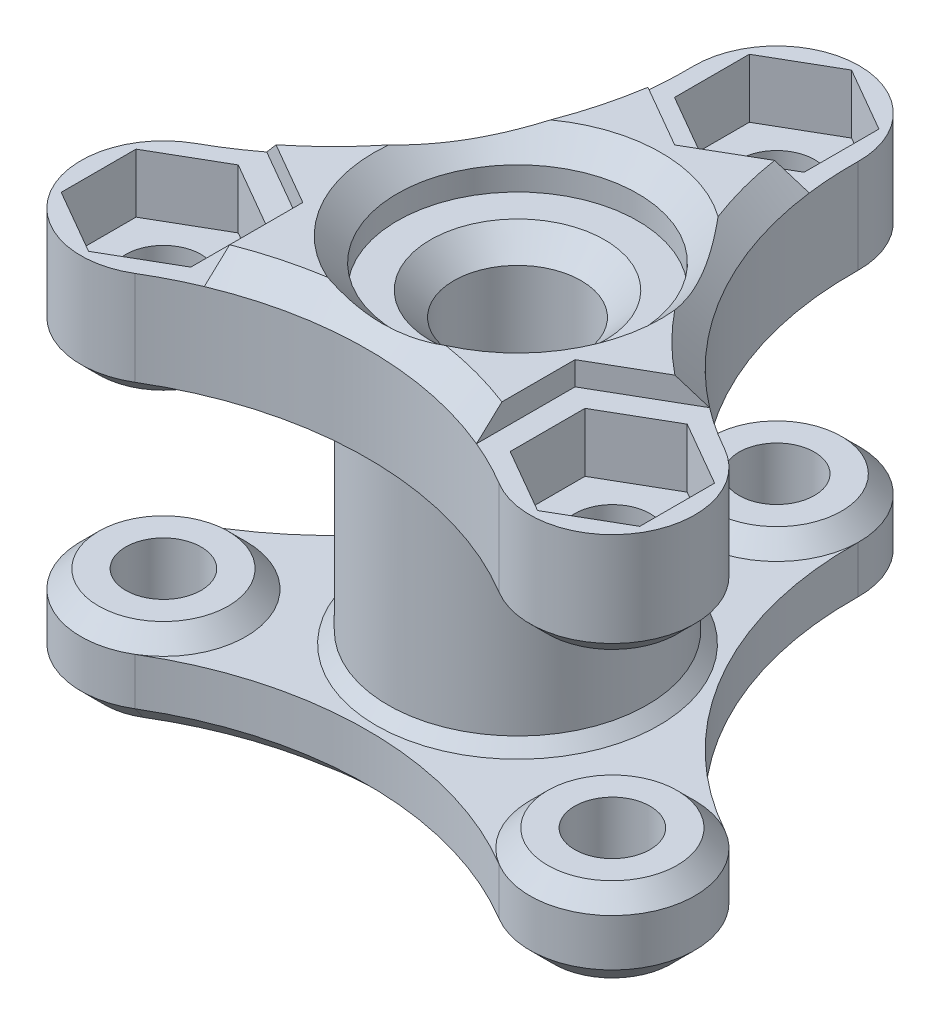
from build123d import *

# Parameters (mm, degrees)
SKETCH1_R           = 1.6
SKETCH1_R_2         = 2.7
BOSS_EXTRUDE1_DEPTH = 3
SKETCH2_R           = 5.5
SKETCH2_R_2         = 2.7
BOSS_EXTRUDE2_DEPTH = 10
SKETCH3_R           = 2.7
SKETCH3_R_2         = 1.6
BOSS_EXTRUDE3_DEPTH = 5
CUT_EXTRUDE2_DEPTH  = 3.5
SKETCH8_R           = 2.5
SKETCH8_R_2         = 1.6
BOSS_EXTRUDE5_DEPTH = 0.75
BOSS_EXTRUDE6_START = 0.75
SKETCH9_R           = 2.5
SKETCH9_R_2         = 1.6
BOSS_EXTRUDE6_DEPTH = 0.75
SKETCH10_R          = 5.1
CUT_EXTRUDE3_DEPTH  = 2
CUT_EXTRUDE4_START  = -3
SKETCH11_R          = 5.1
CUT_EXTRUDE4_DEPTH  = 3
CHAMFER1_SIZE       = 1
CHAMFER2_SIZE       = 1
CHAMFER3_SIZE       = 1
CUT_EXTRUDE5_DEPTH  = 1
CHAMFER4_SIZE       = 0.5
CHAMFER5_SIZE       = 1


with BuildPart() as part:
    # Sketch1 → Boss-Extrude1 (new body)
    with BuildSketch(Plane(origin=(0, 0, 0), x_dir=(1, 0, 0), z_dir=(0, 1, 0))):
        with BuildLine():
            ThreePointArc((3.499474322, 10.939341361), (0, 14.5), (-3.499474322, 10.939341361))
            ThreePointArc((-3.499474322, 10.939341361), (-5.506840359, 3.179375764), (-11.22348468, -2.439037018))
            ThreePointArc((-11.22348468, -2.439037018), (-12.557368355, -7.25), (-7.724010358, -8.500304343))
            ThreePointArc((-7.724010358, -8.500304343), (0, -6.358751527), (7.724010358, -8.500304343))
            ThreePointArc((7.724010358, -8.500304343), (12.557368355, -7.25), (11.22348468, -2.439037018))
            ThreePointArc((11.22348468, -2.439037018), (5.506840359, 3.179375764), (3.499474322, 10.939341361))
        make_face()
        with Locations(Location((0, 11, 0), (0, 0, 270))):
            Circle(SKETCH1_R, mode=Mode.SUBTRACT)
        with Locations(Location((9.526279442, -5.5, 0), (0, 0, 270))):
            Circle(SKETCH1_R, mode=Mode.SUBTRACT)
        with Locations(Location((-9.526279442, -5.5, 0), (0, 0, 270))):
            Circle(SKETCH1_R, mode=Mode.SUBTRACT)
        with Locations(Location((0, 0, 0), (0, 0, 270))):
            Circle(SKETCH1_R_2, mode=Mode.SUBTRACT)
    extrude(amount=BOSS_EXTRUDE1_DEPTH)

    # Sketch2 → Boss-Extrude2 (add)
    with BuildSketch(Plane(origin=(0, 3, 0), x_dir=(1, 0, 0), z_dir=(0, 1, 0))):
        with Locations(Location((0, 0, 0), (0, 0, 270))):
            Circle(SKETCH2_R)
        with Locations(Location((0, 0, 0), (0, 0, 270))):
            Circle(SKETCH2_R_2, mode=Mode.SUBTRACT)
    extrude(amount=BOSS_EXTRUDE2_DEPTH)

    # Sketch3 → Boss-Extrude3 (add)
    with BuildSketch(Plane(origin=(0, 13, 0), x_dir=(1, 0, 0), z_dir=(0, 1, 0))):
        with BuildLine():
            ThreePointArc((-11.22348468, -2.439037018), (-5.506840359, 3.179375764), (-3.499474322, 10.939341361))
            ThreePointArc((-3.499474322, 10.939341361), (0, 14.5), (3.499474322, 10.939341361))
            ThreePointArc((3.499474322, 10.939341361), (5.506840359, 3.179375764), (11.22348468, -2.439037018))
            ThreePointArc((11.22348468, -2.439037018), (12.557368355, -7.25), (7.724010358, -8.500304343))
            ThreePointArc((7.724010358, -8.500304343), (0, -6.358751527), (-7.724010358, -8.500304343))
            ThreePointArc((-7.724010358, -8.500304343), (-12.557368355, -7.25), (-11.22348468, -2.439037018))
        make_face()
        with Locations(Location((0, 0, 0), (0, 0, 270))):
            Circle(SKETCH3_R, mode=Mode.SUBTRACT)
        with Locations(Location((-9.526279442, -5.5, 0), (0, 0, 270))):
            Circle(SKETCH3_R_2, mode=Mode.SUBTRACT)
        with Locations(Location((9.526279442, -5.5, 0), (0, 0, 270))):
            Circle(SKETCH3_R_2, mode=Mode.SUBTRACT)
        with Locations(Location((0, 11, 0), (0, 0, 270))):
            Circle(SKETCH3_R_2, mode=Mode.SUBTRACT)
    extrude(amount=BOSS_EXTRUDE3_DEPTH)

    # Sketch6 → Cut-Extrude2 (cut)
    with BuildSketch(Plane.XZ.offset(-18)):
        Polygon((-12.276279442, 3.91228676), (-9.526279442, 2.324573519), (-6.776279442, 3.91228676), (-6.776279442, 7.08771324), (-9.526279442, 8.675426481), (-12.276279442, 7.08771324), align=None)
        Polygon((2.75, -12.58771324), (2.75, -9.41228676), (0, -7.824573519), (-2.75, -9.41228676), (-2.75, -12.58771324), (0, -14.175426481), align=None)
        Polygon((9.526279442, 8.675426481), (6.776279442, 7.08771324), (6.776279442, 3.91228676), (9.526279442, 2.324573519), (12.276279442, 3.91228676), (12.276279442, 7.08771324), align=None)
    extrude(amount=CUT_EXTRUDE2_DEPTH, mode=Mode.SUBTRACT)

    # Sketch8 → Boss-Extrude5 (add)
    # profile 1 of 3: a face of its own
    with BuildSketch(Plane(origin=(0, 3, 0), x_dir=(1, 0, 0), z_dir=(0, 1, 0))):
        with Locations(Location((-9.526279442, -5.5, 0), (0, 0, 90))):
            Circle(SKETCH8_R)
        with Locations(Location((-9.526279442, -5.5, 0), (0, 0, 270))):
            Circle(SKETCH8_R_2, mode=Mode.SUBTRACT)
    # profile 2 of 3: a face of its own
    with BuildSketch(Plane(origin=(0, 3, 0), x_dir=(1, 0, 0), z_dir=(0, 1, 0))):
        with Locations(Location((0, 11, 0), (0, 0, 90))):
            Circle(SKETCH8_R)
        with Locations(Location((0, 11, 0), (0, 0, 270))):
            Circle(SKETCH8_R_2, mode=Mode.SUBTRACT)
    # profile 3 of 3: a face of its own
    with BuildSketch(Plane(origin=(0, 3, 0), x_dir=(1, 0, 0), z_dir=(0, 1, 0))):
        with Locations(Location((9.526279442, -5.5, 0), (0, 0, 90))):
            Circle(SKETCH8_R)
        with Locations(Location((9.526279442, -5.5, 0), (0, 0, 270))):
            Circle(SKETCH8_R_2, mode=Mode.SUBTRACT)
    extrude(amount=BOSS_EXTRUDE5_DEPTH)

    # Sketch9 → Boss-Extrude6 (add)
    # profile 1 of 3: a face of its own
    with BuildSketch(Plane.XZ.offset(-13).offset(BOSS_EXTRUDE6_START)):
        with Locations(Location((0, -11, 0), (0, 0, 270))):
            Circle(SKETCH9_R)
        with Locations(Location((0, -11, 0), (0, 0, 90))):
            Circle(SKETCH9_R_2, mode=Mode.SUBTRACT)
    # profile 2 of 3: a face of its own
    with BuildSketch(Plane.XZ.offset(-13).offset(BOSS_EXTRUDE6_START)):
        with Locations(Location((-9.526279442, 5.5, 0), (0, 0, 270))):
            Circle(SKETCH9_R)
        with Locations(Location((-9.526279442, 5.5, 0), (0, 0, 90))):
            Circle(SKETCH9_R_2, mode=Mode.SUBTRACT)
    # profile 3 of 3: a face of its own
    with BuildSketch(Plane.XZ.offset(-13).offset(BOSS_EXTRUDE6_START)):
        with Locations(Location((9.526279442, 5.5, 0), (0, 0, 270))):
            Circle(SKETCH9_R)
        with Locations(Location((9.526279442, 5.5, 0), (0, 0, 90))):
            Circle(SKETCH9_R_2, mode=Mode.SUBTRACT)
    extrude(amount=-BOSS_EXTRUDE6_DEPTH)

    # Sketch10 → Cut-Extrude3 (cut)
    with BuildSketch(Plane(origin=(0, 18, 0), x_dir=(1, 0, 0), z_dir=(0, 1, 0))):
        with Locations(Location((0, 0, 0), (0, 0, 270))):
            Circle(SKETCH10_R)
    extrude(amount=-CUT_EXTRUDE3_DEPTH, mode=Mode.SUBTRACT)

    # Sketch11 → Cut-Extrude4 (cut)
    with BuildSketch(Plane.XZ.offset(CUT_EXTRUDE4_START)):
        with Locations(Location((0, 0, 0), (0, 0, 90))):
            Circle(SKETCH11_R)
    extrude(amount=CUT_EXTRUDE4_DEPTH, mode=Mode.SUBTRACT)

    # Chamfer1
    # the kernel refuses this chamfer: 1 mm, written as the material it takes off along each edge
    with BuildSketch(Plane(origin=(0, 0, -11), x_dir=(0.9998498062505288, 0, 0.017331039806656685), z_dir=(-0.017331039806656685, 0, 0.9998498062505288))) as chamfer1_piece_1:
        Polygon((3.5, CHAMFER1_SIZE), (3.5 - CHAMFER1_SIZE, 0), (3.5, 0), align=None)
    revolve(axis=Axis((0, 0, -11), (0, 1, 0)), revolution_arc=181.986090305, mode=Mode.SUBTRACT)
    with BuildSketch(Plane(origin=(9.526279442, 0, 5.5), x_dir=(-0.5149340238718285, 0, 0.8572298122785786), z_dir=(-0.8572298122785786, 0, -0.5149340238718285))) as chamfer1_piece_2:
        Polygon((3.5 - CHAMFER1_SIZE, 0), (3.5, CHAMFER1_SIZE), (3.5, 0), align=None)
    revolve(axis=Axis((9.526279442, 0, 5.5), (0, 1, 0)), revolution_arc=181.986090305, mode=Mode.SUBTRACT)
    with BuildSketch(Plane(origin=(0, 0, 21.358751527), x_dir=(-0.514934023871828, 0, -0.857229812278579), z_dir=(-0.857229812278579, 0, 0.514934023871828))) as chamfer1_piece_3:
        Polygon((15 + CHAMFER1_SIZE, 0), (15, -CHAMFER1_SIZE), (15, 0), align=None)
    revolve(axis=Axis((0, 0, 21.358751527), (0, -1, 0)), revolution_arc=61.986090305, mode=Mode.SUBTRACT)
    with BuildSketch(Plane(origin=(-9.526279442, 0, 5.5), x_dir=(-0.4849157823787002, 0, -0.8745608520852354), z_dir=(0.8745608520852354, 0, -0.4849157823787002))) as chamfer1_piece_4:
        Polygon((3.5 - CHAMFER1_SIZE, 0), (3.5, CHAMFER1_SIZE), (3.5, 0), align=None)
    revolve(axis=Axis((-9.526279442, 0, 5.5), (0, 1, 0)), revolution_arc=181.986090305, mode=Mode.SUBTRACT)
    with BuildSketch(Plane(origin=(0, 18, -11), x_dir=(-0.9998498062505289, 0, 0.017331039806656172), z_dir=(0.017331039806656172, 0, 0.9998498062505289))) as chamfer1_piece_5:
        Polygon((3.5, CHAMFER1_SIZE), (3.5 - CHAMFER1_SIZE, 0), (3.5, 0), align=None)
    revolve(axis=Axis((0, 18, -11), (0, -1, 0)), revolution_arc=181.986090305, mode=Mode.SUBTRACT)
    with BuildSketch(Plane(origin=(-9.526279442, 18, 5.5), x_dir=(0.5149340238718281, 0, 0.8572298122785789), z_dir=(0.8572298122785789, 0, -0.5149340238718281))) as chamfer1_piece_6:
        Polygon((3.5, CHAMFER1_SIZE), (3.5 - CHAMFER1_SIZE, 0), (3.5, 0), align=None)
    revolve(axis=Axis((-9.526279442, 18, 5.5), (0, -1, 0)), revolution_arc=181.986090305, mode=Mode.SUBTRACT)
    with BuildSketch(Plane(origin=(9.526279442, 18, 5.5), x_dir=(0.4849157823786986, 0, -0.8745608520852363), z_dir=(-0.8745608520852363, 0, -0.4849157823786986))) as chamfer1_piece_7:
        Polygon((3.5, CHAMFER1_SIZE), (3.5 - CHAMFER1_SIZE, 0), (3.5, 0), align=None)
    revolve(axis=Axis((9.526279442, 18, 5.5), (0, -1, 0)), revolution_arc=181.986090305, mode=Mode.SUBTRACT)
    with BuildSketch(Plane(origin=(0, 18, 21.358751527), x_dir=(0.5149340238718284, 0, -0.8572298122785788), z_dir=(0.8572298122785788, 0, 0.5149340238718284))) as chamfer1_piece_8:
        Polygon((15, -CHAMFER1_SIZE), (15 + CHAMFER1_SIZE, 0), (15, 0), align=None)
    revolve(axis=Axis((0, 18, 21.358751527), (0, 1, 0)), revolution_arc=61.986090305, mode=Mode.SUBTRACT)
    with BuildSketch(Plane(origin=(18.497221416, 0, -10.679375764), x_dir=(-0.48491578237870064, 0, 0.8745608520852353), z_dir=(0.8745608520852353, 0, 0.48491578237870064))) as chamfer1_piece_9:
        Polygon((15, -CHAMFER1_SIZE), (15 + CHAMFER1_SIZE, 0), (15, 0), align=None)
    revolve(axis=Axis((18.497221416, 0, -10.679375764), (0, -1, 0)), revolution_arc=61.986090305, mode=Mode.SUBTRACT)
    with BuildSketch(Plane(origin=(-18.497221416, 0, -10.679375764), x_dir=(0.9998498062505289, 0, -0.017331039806656054), z_dir=(-0.017331039806656054, 0, -0.9998498062505289))) as chamfer1_piece_10:
        Polygon((15, -CHAMFER1_SIZE), (15 + CHAMFER1_SIZE, 0), (15, 0), align=None)
    revolve(axis=Axis((-18.497221416, 0, -10.679375764), (0, -1, 0)), revolution_arc=61.986090305, mode=Mode.SUBTRACT)
    with BuildSketch(Plane(origin=(-18.497221416, 18, -10.679375764), x_dir=(0.4849157823787007, 0, 0.8745608520852352), z_dir=(-0.8745608520852352, 0, 0.4849157823787007))) as chamfer1_piece_11:
        Polygon((15, -CHAMFER1_SIZE), (15 + CHAMFER1_SIZE, 0), (15, 0), align=None)
    revolve(axis=Axis((-18.497221416, 18, -10.679375764), (0, 1, 0)), revolution_arc=61.986090305, mode=Mode.SUBTRACT)
    with BuildSketch(Plane(origin=(18.497221416, 18, -10.679375764), x_dir=(-0.9998498062505289, 0, -0.017331039806656425), z_dir=(0.017331039806656425, 0, -0.9998498062505289))) as chamfer1_piece_12:
        Polygon((15, -CHAMFER1_SIZE), (15 + CHAMFER1_SIZE, 0), (15, 0), align=None)
    revolve(axis=Axis((18.497221416, 18, -10.679375764), (0, 1, 0)), revolution_arc=61.986090305, mode=Mode.SUBTRACT)

    # Chamfer2
    # the kernel refuses this chamfer: 1 mm, written as the material it takes off along each edge
    with BuildSketch(Plane(origin=(0, 18, 0), x_dir=(0, 0, 1), z_dir=(-1, 0, 0))) as chamfer2_piece_1:
        Polygon((5.1 + CHAMFER2_SIZE, 0), (5.1, -CHAMFER2_SIZE), (5.1, 0), align=None)
    revolve(axis=Axis((0, 18, 0), (0, 1, 0)), mode=Mode.SUBTRACT)
    with BuildSketch(Plane(origin=(0, 0, 0), x_dir=(0, 0, 1), z_dir=(1, 0, 0))) as chamfer2_piece_2:
        Polygon((5.1 + CHAMFER2_SIZE, 0), (5.1, -CHAMFER2_SIZE), (5.1, 0), align=None)
    revolve(axis=Axis((0, 0, 0), (0, -1, 0)), mode=Mode.SUBTRACT)

    # Chamfer3
    # the kernel refuses this chamfer: 1 mm, written as the material it adds along each edge
    with BuildSketch(Plane(origin=(9.526279442, 3, 5.5), x_dir=(0, 0, -1), z_dir=(1, 0, 0))) as chamfer3_piece_1_section:
        Polygon((2.5 + CHAMFER3_SIZE, 0), (2.5, CHAMFER3_SIZE), (2.5, 0), align=None)
    chamfer3_piece_1 = revolve(axis=Axis((9.526279442, 3, 5.5), (0, 1, 0)), mode=Mode.PRIVATE)
    chamfer3_piece_1 = split(chamfer3_piece_1, bisect_by=Plane(origin=(9.526279442, 3.75, 8.610629441), z_dir=(0, -1, 0)), keep=Keep.TOP, mode=Mode.PRIVATE)
    add(chamfer3_piece_1)
    with BuildSketch(Plane(origin=(0, 3, -11), x_dir=(0, 0, -1), z_dir=(1, 0, 0))) as chamfer3_piece_2_section:
        Polygon((2.5 + CHAMFER3_SIZE, 0), (2.5, CHAMFER3_SIZE), (2.5, 0), align=None)
    chamfer3_piece_2 = revolve(axis=Axis((0, 3, -11), (0, 1, 0)), mode=Mode.PRIVATE)
    chamfer3_piece_2 = split(chamfer3_piece_2, bisect_by=Plane(origin=(0, 3.75, -7.889370559), z_dir=(0, -1, 0)), keep=Keep.TOP, mode=Mode.PRIVATE)
    add(chamfer3_piece_2)
    with BuildSketch(Plane(origin=(-9.526279442, 3, 5.5), x_dir=(0, 0, -1), z_dir=(1, 0, 0))) as chamfer3_piece_3_section:
        Polygon((2.5 + CHAMFER3_SIZE, 0), (2.5, CHAMFER3_SIZE), (2.5, 0), align=None)
    chamfer3_piece_3 = revolve(axis=Axis((-9.526279442, 3, 5.5), (0, 1, 0)), mode=Mode.PRIVATE)
    chamfer3_piece_3 = split(chamfer3_piece_3, bisect_by=Plane(origin=(-9.526279442, 3.75, 8.610629441), z_dir=(0, -1, 0)), keep=Keep.TOP, mode=Mode.PRIVATE)
    add(chamfer3_piece_3)
    with BuildSketch(Plane(origin=(9.526279442, 13, 5.5), x_dir=(0, 0, -1), z_dir=(-1, 0, 0))) as chamfer3_piece_4_section:
        Polygon((2.5 + CHAMFER3_SIZE, 0), (2.5, CHAMFER3_SIZE), (2.5, 0), align=None)
    chamfer3_piece_4 = revolve(axis=Axis((9.526279442, 13, 5.5), (0, -1, 0)), mode=Mode.PRIVATE)
    chamfer3_piece_4 = split(chamfer3_piece_4, bisect_by=Plane(origin=(9.526279442, 12.25, 8.610629441), z_dir=(0, 1, 0)), keep=Keep.TOP, mode=Mode.PRIVATE)
    add(chamfer3_piece_4)
    with BuildSketch(Plane(origin=(0, 13, -11), x_dir=(0, 0, -1), z_dir=(-1, 0, 0))) as chamfer3_piece_5_section:
        Polygon((2.5 + CHAMFER3_SIZE, 0), (2.5, CHAMFER3_SIZE), (2.5, 0), align=None)
    chamfer3_piece_5 = revolve(axis=Axis((0, 13, -11), (0, -1, 0)), mode=Mode.PRIVATE)
    chamfer3_piece_5 = split(chamfer3_piece_5, bisect_by=Plane(origin=(0, 12.25, -7.889370559), z_dir=(0, 1, 0)), keep=Keep.TOP, mode=Mode.PRIVATE)
    add(chamfer3_piece_5)
    with BuildSketch(Plane(origin=(-9.526279442, 13, 5.5), x_dir=(0, 0, -1), z_dir=(-1, 0, 0))) as chamfer3_piece_6_section:
        Polygon((2.5 + CHAMFER3_SIZE, 0), (2.5, CHAMFER3_SIZE), (2.5, 0), align=None)
    chamfer3_piece_6 = revolve(axis=Axis((-9.526279442, 13, 5.5), (0, -1, 0)), mode=Mode.PRIVATE)
    chamfer3_piece_6 = split(chamfer3_piece_6, bisect_by=Plane(origin=(-9.526279442, 12.25, 8.610629441), z_dir=(0, 1, 0)), keep=Keep.TOP, mode=Mode.PRIVATE)
    add(chamfer3_piece_6)

    # Sketch12 → Cut-Extrude5 (cut)
    # profile 1 of 3: a face of its own
    with BuildSketch(Plane(origin=(0, 18, 0), x_dir=(1, 0, 0), z_dir=(0, 1, 0))):
        Polygon((3.75, 13.165063509), (0, 15.330127019), (-3.75, 13.165063509), (-3.75, 8.834936491), (0, 6.669872981), (3.75, 8.834936491), align=None)
        Polygon((2.75, 12.58771324), (0, 14.175426481), (-2.75, 12.58771324), (-2.75, 9.41228676), (0, 7.824573519), (2.75, 9.41228676), align=None, mode=Mode.SUBTRACT)
    # profile 2 of 3: a face of its own
    with BuildSketch(Plane(origin=(0, 18, 0), x_dir=(1, 0, 0), z_dir=(0, 1, 0))):
        Polygon((9.526279442, -9.830127019), (13.276279442, -7.665063509), (13.276279442, -3.334936491), (9.526279442, -1.169872981), (5.776279442, -3.334936491), (5.776279442, -7.665063509), align=None)
        Polygon((9.526279442, -8.675426481), (12.276279442, -7.08771324), (12.276279442, -3.91228676), (9.526279442, -2.324573519), (6.776279442, -3.91228676), (6.776279442, -7.08771324), align=None, mode=Mode.SUBTRACT)
    # profile 3 of 3: a face of its own
    with BuildSketch(Plane(origin=(0, 18, 0), x_dir=(1, 0, 0), z_dir=(0, 1, 0))):
        Polygon((-13.276279442, -3.334936491), (-13.276279442, -7.665063509), (-9.526279442, -9.830127019), (-5.776279442, -7.665063509), (-5.776279442, -3.334936491), (-9.526279442, -1.169872981), align=None)
        Polygon((-12.276279442, -3.91228676), (-12.276279442, -7.08771324), (-9.526279442, -8.675426481), (-6.776279442, -7.08771324), (-6.776279442, -3.91228676), (-9.526279442, -2.324573519), align=None, mode=Mode.SUBTRACT)
    extrude(amount=-CUT_EXTRUDE5_DEPTH, mode=Mode.SUBTRACT)

    # Chamfer4
    chamfer4_edges = [part.edges().sort_by_distance(p)[0] for p in [
        (0, 3, -5.5),
        (0, 13, -5.5),
    ]]
    chamfer(chamfer4_edges, length=CHAMFER4_SIZE)

    # Chamfer5
    chamfer5_edges = [part.edges().sort_by_distance(p)[0] for p in [
        (0, 16, -2.7),
        (0, 3, -2.7),
    ]]
    chamfer(chamfer5_edges, length=CHAMFER5_SIZE)


solid = part.part
